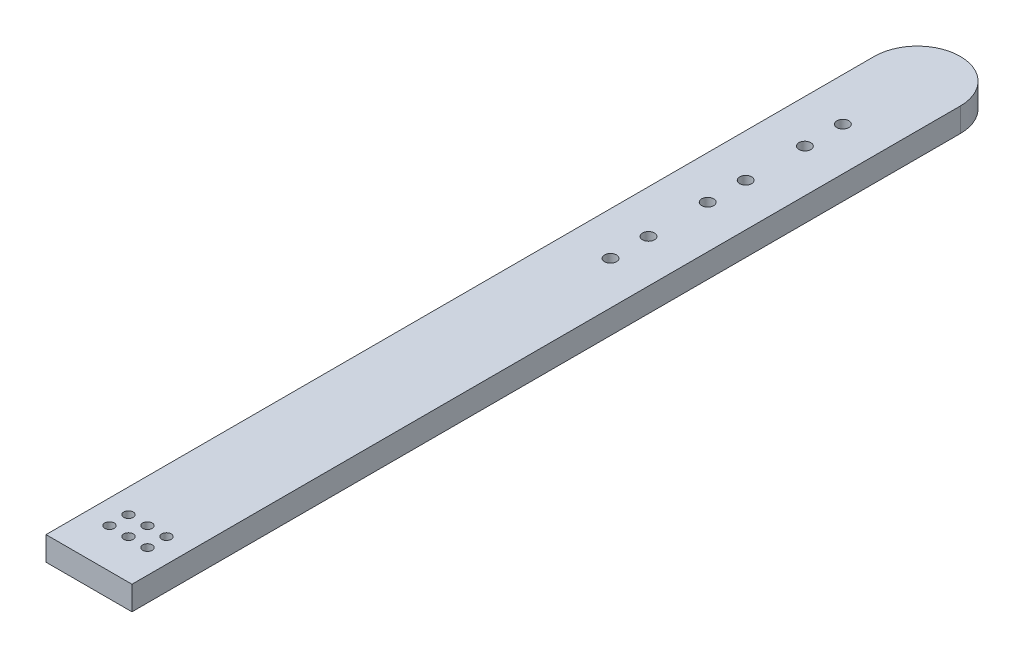
from build123d import *

# Parameters (mm, degrees)
BOSS_EXTRUDE1_DEPTH = 1.6
SKETCH2_R           = 0.3175
SKETCH2_R_2         = 0.4
CUT_EXTRUDE1_DEPTH  = 39.259239815


with BuildPart() as part:
    # Sketch1 → Boss-Extrude1 (new body)
    with BuildSketch(Plane(origin=(0, 0, 0), x_dir=(1, 0, 0), z_dir=(0, 1, 0))):
        with BuildLine():
            Line((-2.875, 35.2425), (-2.875, -20.1575))
            Line((-2.875, -20.1575), (2.875, -20.1575))
            Line((2.875, -20.1575), (2.875, 35.2425))
            ThreePointArc((2.875, 35.2425), (0, 38.1175), (-2.875, 35.2425))
        make_face()
    extrude(amount=BOSS_EXTRUDE1_DEPTH)

    # Sketch2 → Cut-Extrude1 (cut, through all)
    with BuildSketch(Plane.XZ):
        with Locations((1.27, 16.2459)):
            Circle(SKETCH2_R)
        with Locations((0, 16.2459)):
            Circle(SKETCH2_R)
        with Locations((-1.27, 16.2459)):
            Circle(SKETCH2_R)
        with Locations((0, 17.5159)):
            Circle(SKETCH2_R)
        with Locations((-1.27, 17.5159)):
            Circle(SKETCH2_R)
        with Locations((1.27, 17.5159)):
            Circle(SKETCH2_R)
        with Locations((0, -30.2625)):
            Circle(SKETCH2_R_2)
        with Locations((0, -23.7625)):
            Circle(SKETCH2_R_2)
        with Locations((0, -17.2625)):
            Circle(SKETCH2_R_2)
        with Locations((0, -27.7225)):
            Circle(SKETCH2_R_2)
        with Locations((0, -21.2225)):
            Circle(SKETCH2_R_2)
        with Locations((0, -14.7225)):
            Circle(SKETCH2_R_2)
    extrude(amount=-CUT_EXTRUDE1_DEPTH, mode=Mode.SUBTRACT)


solid = part.part
